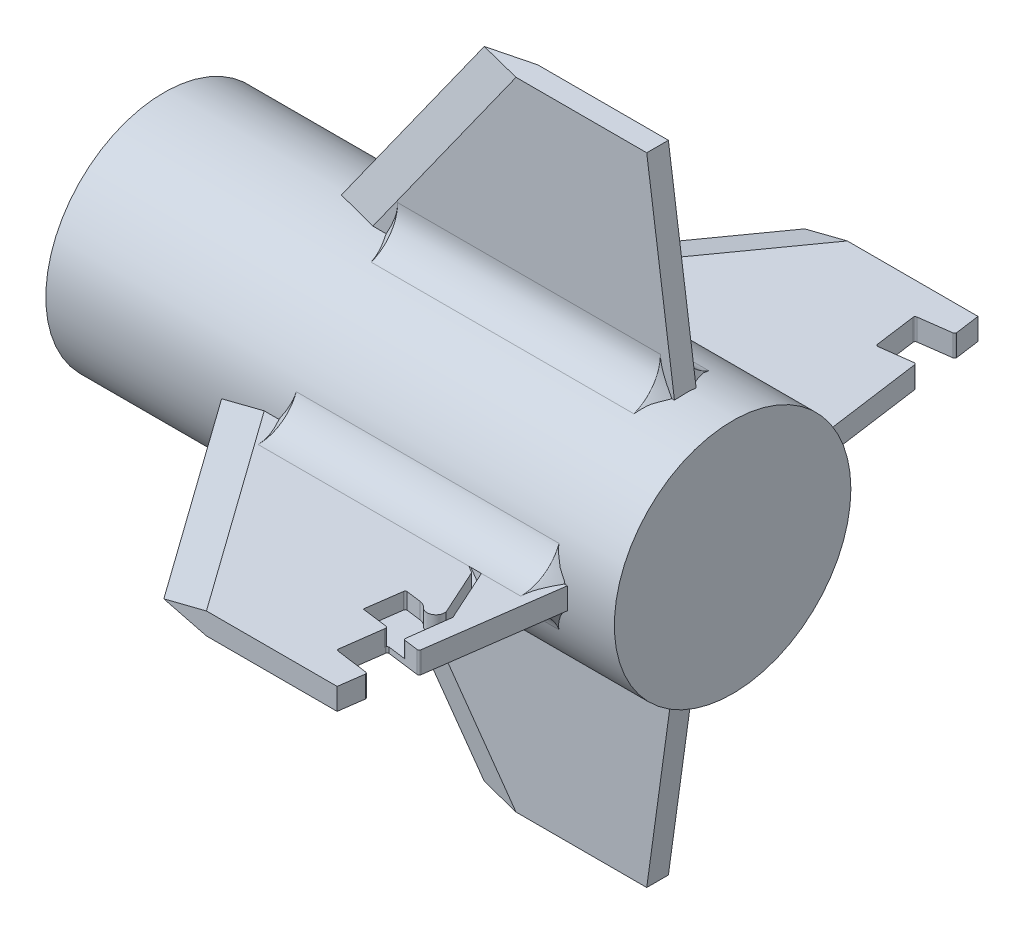
from build123d import *

# Parameters (mm, degrees)
BOSS_EXTRUDE1_DEPTH         = 9.525
CUT_EXTRUDE11_DEPTH         = 109.249530891
CUT_EXTRUDE12_DEPTH         = 109.249530891
CUT_EXTRUDE1_DEPTH          = 164.459241155
FILLET25_R                  = 0.79375
CUT_EXTRUDE8_DEPTH          = 7.112
FILLET31_R                  = 0.79375
BOSS_EXTRUDE7_DEPTH         = 128.5
BOSS_EXTRUDE7_DEPTH_BACK    = 121.5
SKETCH20_R                  = 52
CIRPATTERN6_COUNT           = 2
BOSS_EXTRUDE11_DEPTH        = 4.7625
BOSS_EXTRUDE11_DEPTH_BACK   = 4.7625
BOSS_EXTRUDE11_2_DEPTH      = 4.7625
BOSS_EXTRUDE11_2_DEPTH_BACK = 4.7625
CUT_EXTRUDE14_START         = 11
CUT_EXTRUDE14_DEPTH         = 154.474756751
CUT_EXTRUDE15_DEPTH         = 109.249530891
SKETCH24_R                  = 48.067269017
CUT_EXTRUDE16_DEPTH         = 250
BOSS_EXTRUDE13_DEPTH        = 3
BOSS_EXTRUDE13_DEPTH_BACK   = 122.5
BOSS_EXTRUDE13_START        = -25
BOSS_EXTRUDE13_2_DEPTH      = 3
BOSS_EXTRUDE13_2_DEPTH_BACK = 122.5
BOSS_EXTRUDE13_2_START      = -25
FILLET17_SIZE               = 5
FILLET18_SIZE               = 5
CIRPATTERN9_COUNT           = 4
SKETCH48_R                  = 52
BOSS_EXTRUDE15_DEPTH        = 250


with BuildPart() as part:
    # Sketch2 → Boss-Extrude1 (new body)
    with BuildSketch(Plane(origin=(0, 0, 0), x_dir=(1, 0, 0), z_dir=(0, 1, 0))):
        Polygon((95.501036211, 33.603610094), (107.801036211, 122.503610094), (-44.198963789, 122.503610094), (19.301036211, 33.603610094), align=None)
    extrude(amount=BOSS_EXTRUDE1_DEPTH)

    # Sketch40 → Cut-Extrude11 (cut, along a direction that is not the sketch's normal)
    with BuildSketch(Plane(origin=(0, 0, -122.503610094), x_dir=(-1, 0, 0), z_dir=(0, 0, -1))):
        Polygon((44.198963789, 4.7625), (25.464097027, 0), (44.198963789, 0), align=None)
    extrude(amount=-CUT_EXTRUDE11_DEPTH, dir=(-0.5812381937190961, 0, -0.8137334712067352), mode=Mode.SUBTRACT)

    # Sketch41 → Cut-Extrude12 (cut, along a direction that is not the sketch's normal)
    with BuildSketch(Plane(origin=(0, 0, -122.503610094), x_dir=(-1, 0, 0), z_dir=(0, 0, -1))):
        Polygon((44.198963789, 4.7625), (44.198963789, 9.525), (25.464097027, 9.525), align=None)
    extrude(amount=-CUT_EXTRUDE12_DEPTH, dir=(-0.5812381937190961, 0, -0.8137334712067352), mode=Mode.SUBTRACT)

    # Sketch3 → Cut-Extrude1 (cut, through all)
    with BuildSketch(Plane(origin=(0, 9.525, 0), x_dir=(1, 0, 0), z_dir=(0, 1, 0))):
        Polygon((97.113715989, 45.259482639), (81.457758718, 47.377913426), (84.139549011, 67.197297897), (99.863827857, 65.136307442), align=None)
    extrude(amount=-CUT_EXTRUDE1_DEPTH, mode=Mode.SUBTRACT)

    # Fillet25
    fillet25_edges = [part.edges().sort_by_distance(p)[0] for p in [
        (99.863827857, 4.7625, -65.136307442),
        (97.113715989, 4.7625, -45.259482639),
        (81.457758718, 4.7625, -47.377913426),
        (84.139549011, 4.7625, -67.197297897),
    ]]
    fillet(fillet25_edges, radius=FILLET25_R)

    # Sketch4 → Cut-Extrude8 (cut)
    with BuildSketch(Plane(origin=(0, 9.525, 0), x_dir=(1, 0, 0), z_dir=(0, 1, 0))):
        with BuildLine():
            Line((93.956000122, 80.007694019), (94.626625576, 85.129310246))
            ThreePointArc((94.626625576, 85.129310246), (94.624623336, 85.351200342), (94.561709184, 85.563993747))
            Line((94.561709184, 85.563993747), (84.166615365, 108.42930289))
            ThreePointArc((84.166615365, 108.42930289), (84.03233056, 108.634104903), (83.842381483, 108.788686989))
            Line((83.842381483, 108.788686989), (60.49737734, 122.44927454))
            ThreePointArc((60.49737734, 122.44927454), (60.40077402, 122.489785422), (60.296936592, 122.503610094))
            Line((60.296936592, 122.503610094), (54.464486911, 122.503610094))
            Line((54.464486911, 122.503610094), (58.889378955, 119.91433554))
            Line((58.889378955, 119.91433554), (81.505428428, 106.680303883))
            ThreePointArc((81.505428428, 106.680303883), (81.695377504, 106.525721796), (81.82966231, 106.320919784))
            Line((81.82966231, 106.320919784), (91.05711574, 86.023981731))
            ThreePointArc((91.05711574, 86.023981731), (89.403562167, 82.123240214), (85.167931899, 82.025977477))
            ThreePointArc((85.167931899, 82.025977477), (84.640764026, 82.50367193), (84.106050666, 82.972904901))
            ThreePointArc((84.106050666, 82.972904901), (82.811231696, 83.819271869), (81.324728088, 84.247290827))
            Line((81.324728088, 84.247290827), (74.046769317, 85.20663167))
            Line((74.046769317, 85.20663167), (73.187354806, 78.98382312))
            Line((73.187354806, 78.98382312), (71.783222706, 68.816848836))
            Line((71.783222706, 68.816848836), (84.134706976, 67.197932545))
            Line((84.134706976, 67.197932545), (83.982403289, 66.035935097))
            Line((83.982403289, 66.035935097), (85.092006513, 65.891015289))
            Line((85.092006513, 65.891015289), (84.883355399, 64.293442449))
            Line((84.883355399, 64.293442449), (88.812923978, 63.780220865))
            Line((88.812923978, 63.780220865), (89.173045737, 66.537554528))
            Line((89.173045737, 66.537554528), (92.141275387, 66.148506926))
            Line((92.141275387, 66.148506926), (93.956000122, 80.007694019))
        make_face()
        with BuildLine():
            Line((84.498578608, -92.347727009), (84.746715146, -92.378194345))
            Line((84.746715146, -92.378194345), (83.040544339, -106.273840468))
            Line((83.040544339, -106.273840468), (80.062905884, -105.908232438))
            Line((80.062905884, -105.908232438), (79.726807251, -108.645536137))
            Line((79.726807251, -108.645536137), (75.749643234, -108.1572018))
            Line((75.749643234, -108.1572018), (76.085741867, -105.4198981))
            Line((76.085741867, -105.4198981), (62.693332196, -103.775649516))
            Line((62.693332196, -103.775649516), (64.716379331, -87.299252811))
            Line((64.716379331, -87.299252811), (72.002575296, -88.193885183))
            ThreePointArc((72.002575296, -88.193885183), (73.492823515, -88.608678446), (74.795112026, -89.443506478))
            ThreePointArc((74.795112026, -89.443506478), (75.333973793, -89.907969559), (75.865365559, -90.380960837))
            ThreePointArc((75.865365559, -90.380960837), (77.16765407, -91.215788868), (78.657902289, -91.630582132))
            Line((78.657902289, -91.630582132), (84.498578608, -92.347727009))
        make_face()
    extrude(amount=-CUT_EXTRUDE8_DEPTH, mode=Mode.SUBTRACT)

    # Fillet31
    fillet31_edges = [part.edges().sort_by_distance(p)[0] for p in [
        (92.141275387, 5.969, -66.148506926),
        (84.134706976, 5.969, -67.197932545),
        (74.046769317, 5.969, -85.20663167),
        (54.464486911, 5.969, -122.503610094),
    ]]
    fillet(fillet31_edges, radius=FILLET31_R)


with BuildPart() as body_2:
    # Sketch20 → Boss-Extrude7 (new, two sides: drawn at the far end of the back side and taken through both)
    with BuildSketch(Plane(origin=(0, 0, 0), x_dir=(0, 0, -1), z_dir=(1, 0, 0)).offset(-BOSS_EXTRUDE7_DEPTH_BACK)):
        with Locations((174.503610094, 4.7625)):
            Circle(SKETCH20_R)
    extrude(amount=BOSS_EXTRUDE7_DEPTH + BOSS_EXTRUDE7_DEPTH_BACK)

    # Sketch24 → Cut-Extrude16 (cut)
    with BuildSketch(Plane(origin=(128.5, 0, 0), x_dir=(0, 0, -1), z_dir=(1, 0, 0))):
        with Locations((174.503610094, 4.7625)):
            Circle(SKETCH24_R)
    extrude(amount=-CUT_EXTRUDE16_DEPTH, mode=Mode.SUBTRACT)

    # Sketch48 → Boss-Extrude15 (add)
    with BuildSketch(Plane.ZY.offset(121.5)):
        with Locations(Location((-174.503610094, 4.7625, 0), (0, 0, 180))):
            Circle(SKETCH48_R)
    extrude(amount=-BOSS_EXTRUDE15_DEPTH)


with BuildPart() as cirpattern6_1:
    # CirPattern6: pattern copy
    add(part.part.rotate(Axis((0, 4.7625, -174.503610094), (1, 0, 0)), 1 * 360 / CIRPATTERN6_COUNT))


with BuildPart() as body_4:
    # Sketch35 → Boss-Extrude11 (new, two sides: drawn at the far end of the back side and taken through both)
    with BuildSketch(Plane(origin=(0, 0, -174.503610094), x_dir=(-1, 0, 0), z_dir=(0, 0, -1)).offset(-BOSS_EXTRUDE11_DEPTH_BACK)):
        Polygon((44.198963789, -46.2375), (-107.801036211, -46.2375), (-95.501036211, -135.1375), (-19.301036211, -135.1375), align=None)
    extrude(amount=BOSS_EXTRUDE11_DEPTH + BOSS_EXTRUDE11_DEPTH_BACK)

    # Cut-Extrude14: read off the stored shape, not the designer's step
    # Cut-Extrude14 outline → Cut-Extrude14 (cut)
    with BuildSketch(Plane(origin=(0, 0, 0), x_dir=(0.8137334712067363, 0.5812381937190946, 0), z_dir=(0.5812381937190946, -0.8137334712067362, 0)).offset(CUT_EXTRUDE14_START)):
        Polygon((-62.84117721, -179.266110094), (-47.595989016, -179.266110094), (-62.84117721, -174.503610094), align=None)
        Polygon((-62.84117721, -169.741110094), (-62.84117721, -174.503610094), (-47.595989016, -169.741110094), align=None)
    extrude(amount=CUT_EXTRUDE14_DEPTH, mode=Mode.SUBTRACT)


with BuildPart() as body_5:
    # Sketch35 → Boss-Extrude11 2 (new, two sides: drawn at the far end of the back side and taken through both)
    with BuildSketch(Plane(origin=(0, 0, -174.503610094), x_dir=(-1, 0, 0), z_dir=(0, 0, -1)).offset(-BOSS_EXTRUDE11_2_DEPTH_BACK)):
        Polygon((-95.501036211, 144.6625), (-107.801036211, 55.7625), (44.198963789, 55.7625), (-19.301036211, 144.6625), align=None)
    extrude(amount=BOSS_EXTRUDE11_2_DEPTH + BOSS_EXTRUDE11_2_DEPTH_BACK)

    # Sketch44 → Cut-Extrude15 (cut, along a direction that is not the sketch's normal)
    with BuildSketch(Plane.XZ.offset(-55.7625)):
        Polygon((-44.198963789, -169.741110094), (-44.198963789, -174.503610094), (-25.464096989, -169.741110094), align=None)
        Polygon((-25.464096989, -179.266110094), (-44.198963789, -174.503610094), (-44.198963789, -179.266110094), align=None)
    extrude(amount=-CUT_EXTRUDE15_DEPTH, dir=(-0.5812381937190975, -0.8137334712067342, 0), mode=Mode.SUBTRACT)


with BuildPart() as body_6:
    # Sketch47 → Boss-Extrude13 (new, two sides: drawn at the far end of the back side and taken through both)
    with BuildSketch(Plane(origin=(128.5, 0, 0), x_dir=(0, 0, -1), z_dir=(1, 0, 0)).offset(BOSS_EXTRUDE13_START - BOSS_EXTRUDE13_DEPTH_BACK)):
        with BuildLine():
            Line((179.266110094, 56.543950286), (190.945601182, 54.103331206))
            ThreePointArc((190.945601182, 54.103331206), (182.472359831, 60.683492207), (179.266110094, 70.921377752))
            Line((179.266110094, 70.921377752), (179.266110094, 56.543950286))
        make_face()
    extrude(amount=BOSS_EXTRUDE13_DEPTH + BOSS_EXTRUDE13_DEPTH_BACK)

    # Fillet17
    # a fillet whose section is not a circle: 5 mm, written as the material it takes off along each edge
    with BuildSketch(Plane(origin=(106.5, 70.921377752, -197.214546311), x_dir=(0, -0.6767673343503575, -0.7361969676359115), z_dir=(0, 0.7361969676359115, -0.6767673343503575))) as fillet17_piece_1:
        with BuildLine():
            Bezier((17.948436217, FILLET17_SIZE), (17.948436217, 0), (17.948436217 + FILLET17_SIZE, 0), weights=[1, 0.037216146, 1])
            Line((17.948436217 + FILLET17_SIZE, 0), (17.948436217, 0))
            Line((17.948436217, 0), (17.948436217, FILLET17_SIZE))
        make_face()
    revolve(axis=Axis((106.5, 70.921377752, -197.214546311), (-1, 0, 0)), revolution_arc=177.321072871, mode=Mode.SUBTRACT)
    with BuildSketch(Plane(origin=(-19, 70.921377752, -197.214546311), x_dir=(0, -0.6767673343503575, -0.7361969676359115), z_dir=(0, 0.7361969676359115, -0.6767673343503575))) as fillet17_piece_2:
        with BuildLine():
            Bezier((17.948436217 + FILLET17_SIZE, 0), (17.948436217, 0), (17.948436217, -FILLET17_SIZE), weights=[1, 0.037216146, 1])
            Line((17.948436217, -FILLET17_SIZE), (17.948436217, 0))
            Line((17.948436217, 0), (17.948436217 + FILLET17_SIZE, 0))
        make_face()
    revolve(axis=Axis((-19, 70.921377752, -197.214546311), (-1, 0, 0)), revolution_arc=177.321072871, mode=Mode.SUBTRACT)


with BuildPart() as body_7:
    # Sketch47 → Boss-Extrude13 2 (new, two sides: drawn at the far end of the back side and taken through both)
    with BuildSketch(Plane(origin=(128.5, 0, 0), x_dir=(0, 0, -1), z_dir=(1, 0, 0)).offset(BOSS_EXTRUDE13_2_START - BOSS_EXTRUDE13_2_DEPTH_BACK)):
        with BuildLine():
            Line((169.741110094, 56.543950286), (158.061619005, 54.103331206))
            ThreePointArc((158.061619005, 54.103331206), (166.534860357, 60.683492207), (169.741110094, 70.921377752))
            Line((169.741110094, 70.921377752), (169.741110094, 56.543950286))
        make_face()
    extrude(amount=BOSS_EXTRUDE13_2_DEPTH + BOSS_EXTRUDE13_2_DEPTH_BACK)

    # Fillet18
    # a fillet whose section is not a circle: 5 mm, written as the material it takes off along each edge
    with BuildSketch(Plane(origin=(-19, 70.921377752, -151.792673876), x_dir=(0, -0.6767673343503461, 0.7361969676359219), z_dir=(0, 0.7361969676359219, 0.6767673343503461))) as fillet18_piece_1:
        with BuildLine():
            Bezier((17.948436217 + FILLET18_SIZE, 0), (17.948436217, 0), (17.948436217, FILLET18_SIZE), weights=[1, 0.037216146, 1])
            Line((17.948436217, FILLET18_SIZE), (17.948436217, 0))
            Line((17.948436217, 0), (17.948436217 + FILLET18_SIZE, 0))
        make_face()
    revolve(axis=Axis((-19, 70.921377752, -151.792673876), (1, 0, 0)), revolution_arc=177.321072871, mode=Mode.SUBTRACT)
    with BuildSketch(Plane(origin=(106.5, 70.921377752, -151.792673876), x_dir=(0, -0.6767673343503461, 0.7361969676359219), z_dir=(0, 0.7361969676359219, 0.6767673343503461))) as fillet18_piece_2:
        with BuildLine():
            Bezier((17.948436217, -FILLET18_SIZE), (17.948436217, 0), (17.948436217 + FILLET18_SIZE, 0), weights=[1, 0.037216146, 1])
            Line((17.948436217 + FILLET18_SIZE, 0), (17.948436217, 0))
            Line((17.948436217, 0), (17.948436217, -FILLET18_SIZE))
        make_face()
    revolve(axis=Axis((106.5, 70.921377752, -151.792673876), (1, 0, 0)), revolution_arc=177.321072871, mode=Mode.SUBTRACT)


with BuildPart() as cirpattern9_1:
    # CirPattern9: pattern copy
    add(body_7.part.rotate(Axis((128.5, 4.7625, -174.503610094), (1, 0, 0)), 1 * 360 / CIRPATTERN9_COUNT))


with BuildPart() as cirpattern9_2:
    # CirPattern9: pattern copy
    add(body_7.part.rotate(Axis((128.5, 4.7625, -174.503610094), (1, 0, 0)), 2 * 360 / CIRPATTERN9_COUNT))


with BuildPart() as cirpattern9_3:
    # CirPattern9: pattern copy
    add(body_7.part.rotate(Axis((128.5, 4.7625, -174.503610094), (1, 0, 0)), 3 * 360 / CIRPATTERN9_COUNT))


with BuildPart() as cirpattern9_4:
    # CirPattern9: pattern copy
    add(body_6.part.rotate(Axis((128.5, 4.7625, -174.503610094), (1, 0, 0)), 1 * 360 / CIRPATTERN9_COUNT))


with BuildPart() as cirpattern9_5:
    # CirPattern9: pattern copy
    add(body_6.part.rotate(Axis((128.5, 4.7625, -174.503610094), (1, 0, 0)), 2 * 360 / CIRPATTERN9_COUNT))


with BuildPart() as cirpattern9_6:
    # CirPattern9: pattern copy
    add(body_6.part.rotate(Axis((128.5, 4.7625, -174.503610094), (1, 0, 0)), 3 * 360 / CIRPATTERN9_COUNT))


solid = Compound([part.part, body_2.part, cirpattern6_1.part, body_4.part, body_5.part, body_6.part, body_7.part, cirpattern9_1.part, cirpattern9_2.part, cirpattern9_3.part, cirpattern9_4.part, cirpattern9_5.part, cirpattern9_6.part])
